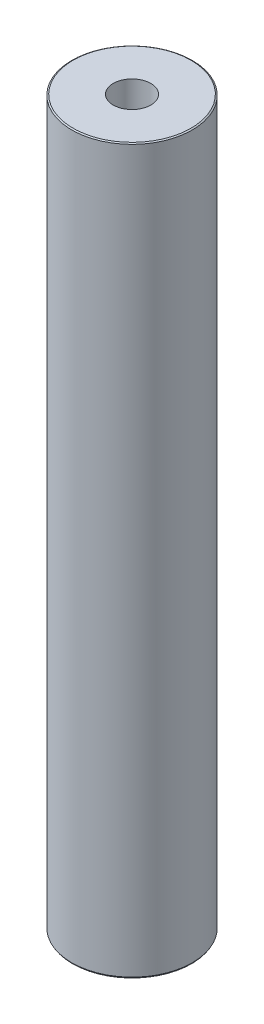
from build123d import *
from OCP.BRepFilletAPI import BRepFilletAPI_MakeChamfer

# Parameters (mm, degrees)
SKETCH1_R           = 50
BOSS_EXTRUDE1_DEPTH = 600
SKETCH2_R           = 15.586395941
CUT_EXTRUDE1_DEPTH  = 605.15229868
CHAMFER1_SIZE       = 0.671092558
CHAMFER1_SIZE2      = 1.097319866


with BuildPart() as part:
    # Sketch1 → Boss-Extrude1 (new body)
    with BuildSketch(Plane(origin=(0, 0, 0), x_dir=(1, 0, 0), z_dir=(0, 1, 0))):
        Circle(SKETCH1_R)
    extrude(amount=BOSS_EXTRUDE1_DEPTH)

    # Sketch2 → Cut-Extrude1 (cut, through all)
    with BuildSketch(Plane(origin=(0, 0, 0), x_dir=(1, 0, 0), z_dir=(0, 1, 0))):
        Circle(SKETCH2_R)
    extrude(amount=CUT_EXTRUDE1_DEPTH, mode=Mode.SUBTRACT)

    # Chamfer1: one chamfer whose edges measure the first distance from different faces: ONE call of the kernel's chamfer builder (chamfer() names one face for all edges)
    chamfer1_edges_1 = [part.edges().sort_by_distance(p)[0] for p in [
        (-50, 600, 0),
    ]]
    chamfer1_side_1 = [part.faces().sort_by_distance(p)[0] for p in [
        (-50, 300, 0),
    ]]
    chamfer1_edges_2 = [part.edges().sort_by_distance(p)[0] for p in [
        (-50, 0, 0),
    ]]
    chamfer1_side_2 = [part.faces().sort_by_distance(p)[0] for p in [
        (-48.585786438, 0, 0),
    ]]
    chamfer1 = BRepFilletAPI_MakeChamfer(part.part.solid().wrapped)
    for e in chamfer1_edges_1:
        chamfer1.Add(CHAMFER1_SIZE, CHAMFER1_SIZE2, e.wrapped, chamfer1_side_1[0].wrapped)  # the first distance lies on this face
    for e in chamfer1_edges_2:
        chamfer1.Add(CHAMFER1_SIZE, CHAMFER1_SIZE2, e.wrapped, chamfer1_side_2[0].wrapped)  # the first distance lies on this face
    add(Compound.cast(chamfer1.Shape()), mode=Mode.REPLACE)


solid = part.part
